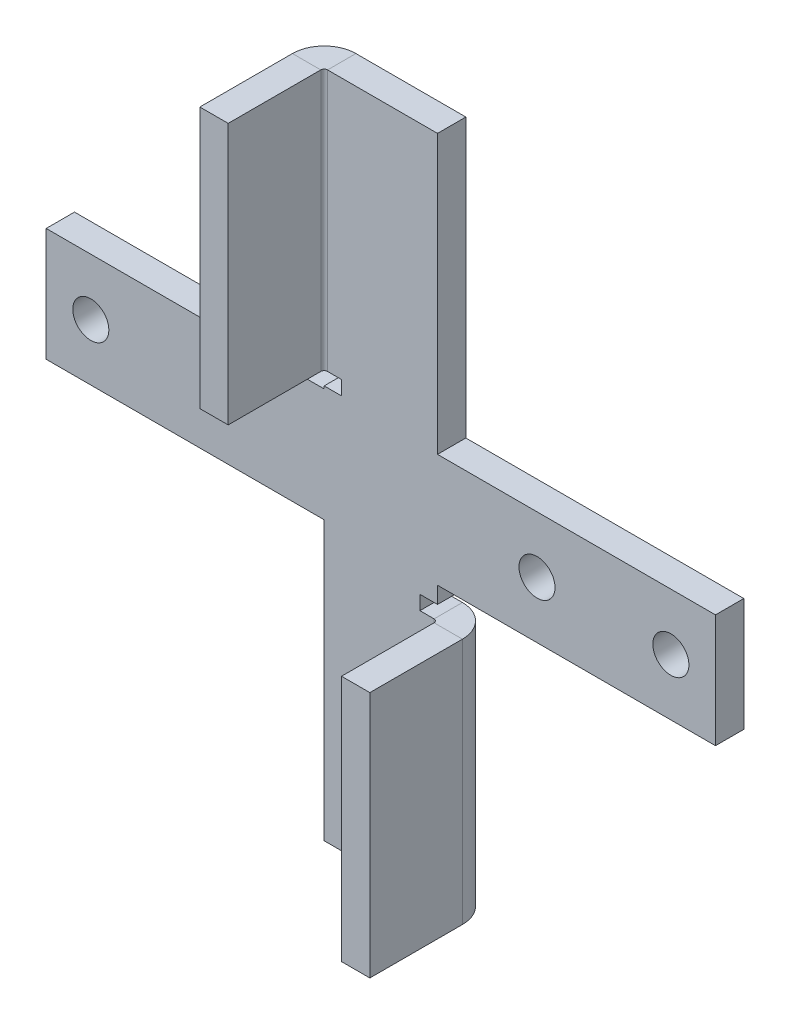
from build123d import *

# Parameters (mm, degrees)
SKETCH1_W                       = 31.15
SKETCH1_H                       = 12.7
SKETCH1_W_2                     = 12.7
SKETCH1_H_2                     = 31.15
BOSS_EXTRUDE1_DEPTH             = 3.175
F_10_32_TAPPED_HOLE1_D          = 4.0386
F_10_32_TAPPED_HOLE1_DEPTH      = 12.7
F_10_32_TAPPED_HOLE1_TIP        = 1.213317848
EDGE_FLANGE1_STRIP_W            = 13.462
EDGE_FLANGE1_STRIP_H            = 3.175
EDGE_FLANGE1_STRIP_CUT_DEPTH    = 27.696197319
EDGE_FLANGE1_RELIEF_W           = 15.0495
EDGE_FLANGE1_RELIEF_H           = 1.5875
EDGE_FLANGE1_RELIEF_CUT_DEPTH   = 3.175
EDGE_FLANGE1_STRIP_2_W          = 13.462
EDGE_FLANGE1_STRIP_2_H          = 3.175
EDGE_FLANGE1_STRIP_CUT_2_DEPTH  = 29.266530926
EDGE_FLANGE1_RELIEF_2_W         = 15.0495
EDGE_FLANGE1_RELIEF_2_H         = 1.5875
EDGE_FLANGE1_RELIEF_CUT_2_DEPTH = 3.175
EDGE_FLANGE1_DEPTH              = 27.696197319
EDGE_FLANGE1_BEND_DEPTH         = 29.266530926


# Sheet-metal steps are written as plain solids
with BuildPart() as part:
    # Sketch1 → Boss-Extrude1 (new body)
    with BuildSketch(Plane.XY):
        with Locations((-21.925, 0)):
            Rectangle(SKETCH1_W, SKETCH1_H)
        Rectangle(SKETCH1_W_2, SKETCH1_H)
        with Locations((0, -21.925)):
            Rectangle(SKETCH1_W_2, SKETCH1_H_2)
        with Locations((21.925, 0)):
            Rectangle(SKETCH1_W, SKETCH1_H)
        with Locations((0, 21.925)):
            Rectangle(SKETCH1_W_2, SKETCH1_H_2)
    extrude(amount=-BOSS_EXTRUDE1_DEPTH)

    # #10-32 Tapped Hole1
    with Locations(Plane.XY):
        with Locations((-17.5, 0), (-32.5, 0), (17.5, 0), (32.5, 0)):
            Hole(F_10_32_TAPPED_HOLE1_D / 2, depth=F_10_32_TAPPED_HOLE1_DEPTH)
            with Locations((0, 0, -(F_10_32_TAPPED_HOLE1_DEPTH + F_10_32_TAPPED_HOLE1_TIP / 2))):  # 118° drill point
                Cone(0, F_10_32_TAPPED_HOLE1_D / 2, F_10_32_TAPPED_HOLE1_TIP, mode=Mode.SUBTRACT)

    # Edge-Flange1 strip (across the edge) → Edge-Flange1 strip cut (cut)
    with BuildSketch(Plane(origin=(6.35, -37.5, 0), x_dir=(-1, 0, 0), z_dir=(0, 1, 0))):
        with Locations((-6.35, -1.5875)):
            Rectangle(EDGE_FLANGE1_STRIP_W, EDGE_FLANGE1_STRIP_H)
    extrude(amount=EDGE_FLANGE1_STRIP_CUT_DEPTH, mode=Mode.SUBTRACT)

    # Edge-Flange1 relief (on the sheet) → Edge-Flange1 relief cut (cut)
    with BuildSketch(Plane(origin=(5.969, -37.5, 0), x_dir=(-1, 0, 0), z_dir=(0, 0, 1))):
        with Locations((-5.93725, -28.489947319)):
            Rectangle(EDGE_FLANGE1_RELIEF_W, EDGE_FLANGE1_RELIEF_H)
    extrude(amount=-EDGE_FLANGE1_RELIEF_CUT_DEPTH, mode=Mode.SUBTRACT)

    # Edge-Flange1 strip 2 (across the edge) → Edge-Flange1 strip cut 2 (cut)
    with BuildSketch(Plane(origin=(-6.35, 37.5, 0), x_dir=(1, 0, 0), z_dir=(0, -1, 0))):
        with Locations((-6.35, -1.5875)):
            Rectangle(EDGE_FLANGE1_STRIP_2_W, EDGE_FLANGE1_STRIP_2_H)
    extrude(amount=EDGE_FLANGE1_STRIP_CUT_2_DEPTH, mode=Mode.SUBTRACT)

    # Edge-Flange1 relief 2 (on the sheet) → Edge-Flange1 relief cut 2 (cut)
    with BuildSketch(Plane(origin=(-5.969, 37.5, 0), x_dir=(1, 0, 0), z_dir=(0, 0, 1))):
        with Locations((-5.93725, -30.060280926)):
            Rectangle(EDGE_FLANGE1_RELIEF_2_W, EDGE_FLANGE1_RELIEF_2_H)
    extrude(amount=-EDGE_FLANGE1_RELIEF_CUT_2_DEPTH, mode=Mode.SUBTRACT)

    # Edge-Flange1 section (across the edge) → Edge-Flange1 (add)
    with BuildSketch(Plane(origin=(6.35, -37.5, 0), x_dir=(-1, 0, 0), z_dir=(0, 1, 0))):
        with BuildLine():
            Line((-3.175, 0.381), (-3.175, 10.756))
            Line((-3.175, 10.756), (0, 10.756))
            Line((0, 10.756), (0, 0.381))
            ThreePointArc((0, 0.381), (0.111592316, 0.111592316), (0.381, 0))
            Line((0.381, 0), (0.381, -3.175))
            ThreePointArc((0.381, -3.175), (-2.133471714, -2.133471714), (-3.175, 0.381))
        make_face()
    extrude(amount=EDGE_FLANGE1_DEPTH)

    # Edge-Flange1 section 2 (across the edge) → Edge-Flange1 bend (add)
    with BuildSketch(Plane(origin=(-6.35, 37.5, 0), x_dir=(1, 0, 0), z_dir=(0, -1, 0))):
        with BuildLine():
            Line((-3.175, 0.381), (-3.175, 10.756))
            Line((-3.175, 10.756), (0, 10.756))
            Line((0, 10.756), (0, 0.381))
            ThreePointArc((0, 0.381), (0.111592316, 0.111592316), (0.381, 0))
            Line((0.381, 0), (0.381, -3.175))
            ThreePointArc((0.381, -3.175), (-2.133471714, -2.133471714), (-3.175, 0.381))
        make_face()
    extrude(amount=EDGE_FLANGE1_BEND_DEPTH)


solid = part.part
